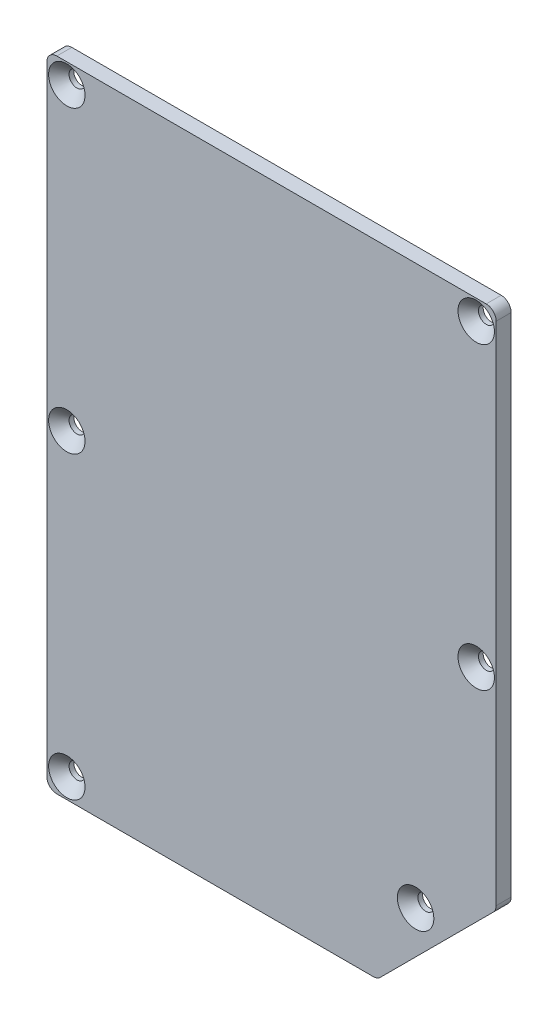
from build123d import *

# Parameters (mm, degrees)
BOSS_EXTRUDE1_DEPTH                                 = 3
CSK_FOR_M3_COUNTERSUNK_FLAT_HEAD_SCREW1_D           = 3.2
CSK_FOR_M3_COUNTERSUNK_FLAT_HEAD_SCREW1_DEPTH       = 5
CSK_FOR_M3_COUNTERSUNK_FLAT_HEAD_SCREW1_CSINK_D     = 7.3
CSK_FOR_M3_COUNTERSUNK_FLAT_HEAD_SCREW1_CSINK_ANGLE = 90
CSK_FOR_M3_COUNTERSUNK_FLAT_HEAD_SCREW1_TIP         = 0.96137699


with BuildPart() as part:
    # Sketch1 → Boss-Extrude1 (new body)
    with BuildSketch(Plane.XY):
        with BuildLine():
            Line((-45, 66), (-45, -58))
            ThreePointArc((-45, -58), (-44.414213562, -59.414213562), (-43, -60))
            Line((-43, -60), (20.384776311, -60))
            ThreePointArc((20.384776311, -60), (21.150143176, -59.847759065), (21.798989873, -59.414213562))
            Line((21.798989873, -59.414213562), (44.414213562, -36.798989873))
            ThreePointArc((44.414213562, -36.798989873), (44.847759065, -36.150143176), (45, -35.384776311))
            Line((45, -35.384776311), (45, 66))
            ThreePointArc((45, 66), (44.414213562, 67.414213562), (43, 68))
            Line((43, 68), (-43, 68))
            ThreePointArc((-43, 68), (-44.414213562, 67.414213562), (-45, 66))
        make_face()
    extrude(amount=BOSS_EXTRUDE1_DEPTH)

    # CSK for M3 Countersunk Flat Head Screw1
    with Locations(Plane(origin=(-41, -56, 3), x_dir=(1, 0, 0), z_dir=(0, 0, 1))):
        with Locations((0, 0), (69.863961031, 12.136038969), (82, 60), (0, 60), (0, 120), (82, 120)):
            CounterSinkHole(CSK_FOR_M3_COUNTERSUNK_FLAT_HEAD_SCREW1_D / 2, CSK_FOR_M3_COUNTERSUNK_FLAT_HEAD_SCREW1_CSINK_D / 2, depth=CSK_FOR_M3_COUNTERSUNK_FLAT_HEAD_SCREW1_DEPTH, counter_sink_angle=CSK_FOR_M3_COUNTERSUNK_FLAT_HEAD_SCREW1_CSINK_ANGLE)
            with Locations((0, 0, -(CSK_FOR_M3_COUNTERSUNK_FLAT_HEAD_SCREW1_DEPTH + CSK_FOR_M3_COUNTERSUNK_FLAT_HEAD_SCREW1_TIP / 2))):  # 118° drill point
                Cone(0, CSK_FOR_M3_COUNTERSUNK_FLAT_HEAD_SCREW1_D / 2, CSK_FOR_M3_COUNTERSUNK_FLAT_HEAD_SCREW1_TIP, mode=Mode.SUBTRACT)


solid = part.part
